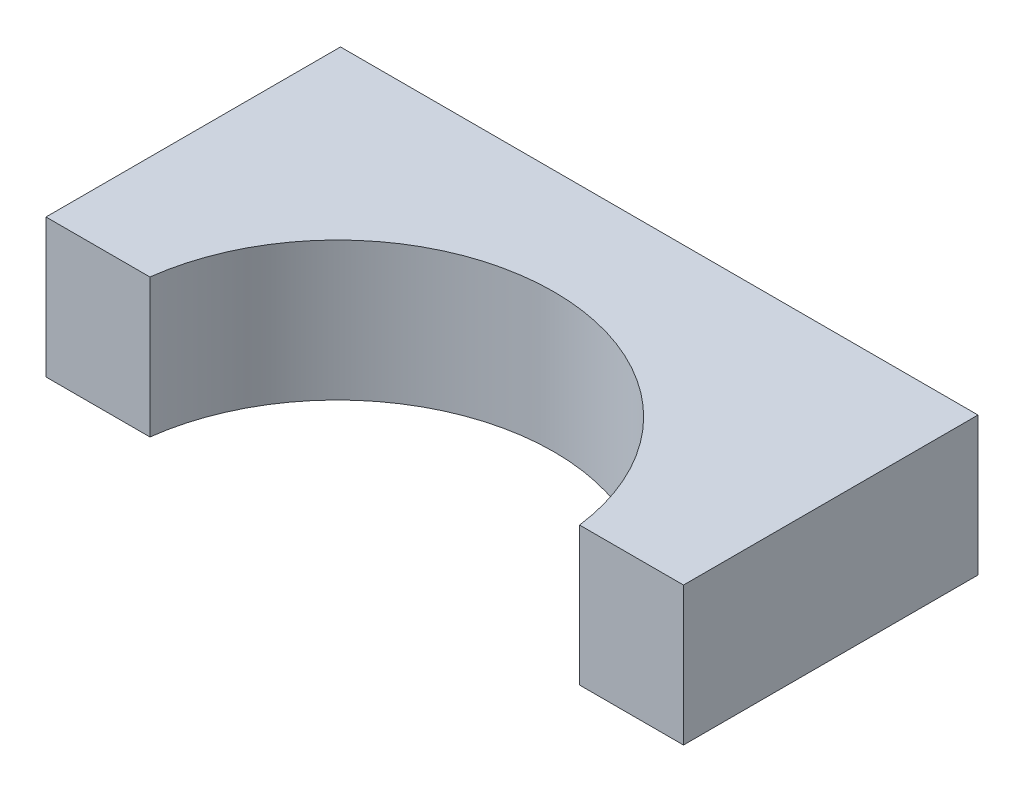
from build123d import *

# Parameters (mm, degrees)
BOSS_EXTRUDE1_DEPTH = 10.16
SKETCH6_R           = 1.6002
CUT_EXTRUDE1_DEPTH  = 4.064


with BuildPart() as part:
    # Sketch2 → Boss-Extrude1 (new body)
    with BuildSketch(Plane(origin=(0, 0, 0), x_dir=(1, 0, 0), z_dir=(0, 1, 0))):
        with BuildLine():
            Line((-14.986, -8.89), (-7.366, -8.89))
            ThreePointArc((-7.366, -8.89), (8.382, 4.980973803), (24.13, -8.89))
            Line((24.13, -8.89), (31.75, -8.89))
            Line((31.75, -8.89), (31.75, 12.7))
            Line((31.75, 12.7), (-14.986, 12.7))
            Line((-14.986, 12.7), (-14.986, -8.89))
        make_face()
    extrude(amount=-BOSS_EXTRUDE1_DEPTH)

    # Sketch6 → Cut-Extrude1 (cut)
    with BuildSketch(Plane(origin=(0, 0, -12.7), x_dir=(-1, 0, 0), z_dir=(0, 0, -1))):
        with Locations((11.176, -5.08)):
            Circle(SKETCH6_R)
        with Locations((-27.94, -5.08)):
            Circle(SKETCH6_R)
    extrude(amount=-CUT_EXTRUDE1_DEPTH, mode=Mode.SUBTRACT)


solid = part.part
